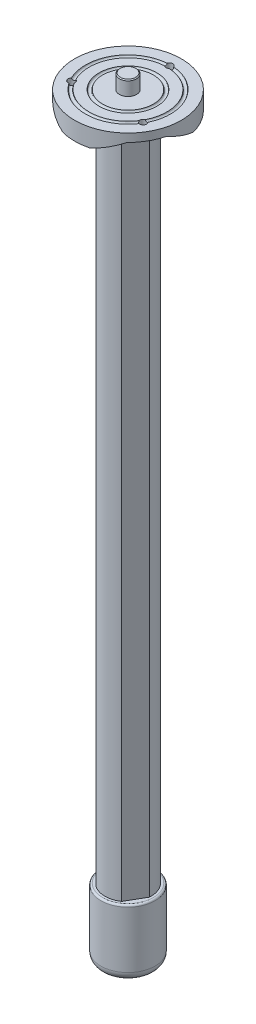
from build123d import *

# Parameters (mm, degrees)
EXTRUDE1_DEPTH                  = 185
SKETCH3_R                       = 29.5
EXTRUDE2_DEPTH                  = 10
SKETCH7_R                       = 1
SKETCH6_OUTSIDE_W               = 138.81
SKETCH6_OUTSIDE_H               = 138.81
SKETCH6_OUTSIDE_R               = 29.5
SKETCH6_OUTSIDE_R_2             = 25.5
EXTRUDE4_DEPTH                  = 5.5
EXTRUDE3_DEPTH                  = 23
CIRPATTERN1_COUNT               = 3
SKETCH8_R                       = 4.7625
EXTRUDE5_DEPTH                  = 8
CHAMFER1_SIZE                   = 0.5
EXTRUDE6_DEPTH                  = 8
FILLET1_R                       = 5
FILLET2_R                       = 1
SKETCH13_W                      = 1.89865
SKETCH13_H                      = 420
F_10_24_TAPPED_HOLE1_AT_2_COUNT = 2
F_10_24_TAPPED_HOLE1_AT_2_PITCH = 39.594681461
F_10_24_TAPPED_HOLE1_AT_3_COUNT = 2
F_10_24_TAPPED_HOLE1_AT_3_PITCH = 39.594681461


with BuildPart() as part:
    # Sketch2 → Extrude1 (new, symmetric)
    with BuildSketch(Plane(origin=(0, 0, 0), x_dir=(1, 0, 0), z_dir=(0, 1, 0))):
        with BuildLine():
            Line((-5.6, 11.45436598), (5.6, 11.45436598))
            ThreePointArc((5.6, 11.45436598), (11.041823898, 6.375), (12.719771923, -0.877440729))
            Line((12.719771923, -0.877440729), (7.119771923, -10.576925251))
            ThreePointArc((7.119771923, -10.576925251), (0, -12.75), (-7.119771923, -10.576925251))
            Line((-7.119771923, -10.576925251), (-12.719771923, -0.877440729))
            ThreePointArc((-12.719771923, -0.877440729), (-11.041823898, 6.375), (-5.6, 11.45436598))
        make_face()
    extrude(amount=EXTRUDE1_DEPTH, both=True)


with BuildPart() as body_2:
    # Sketch3 → Extrude2 (new body)
    with BuildSketch(Plane(origin=(0, 185, 0), x_dir=(1, 0, 0), z_dir=(0, 1, 0))):
        Circle(SKETCH3_R)
    extrude(amount=EXTRUDE2_DEPTH)

    # Sketch7 → Cut-Revolve1 (revolve, cut)
    with BuildSketch(Plane.XY):
        with Locations((15, 195)):
            Circle(SKETCH7_R)
        with Locations((22.5, 195)):
            Circle(SKETCH7_R)
    revolve(axis=Axis((0, 203.822792645, 0), (0, -1, 0)), mode=Mode.SUBTRACT)

    # Sketch6 outside → Extrude4 (cut)
    # profile 1 of 2: a face of its own
    with BuildSketch(Plane.XZ.offset(-185)):
        Rectangle(SKETCH6_OUTSIDE_W, SKETCH6_OUTSIDE_H)
        Circle(SKETCH6_OUTSIDE_R, mode=Mode.SUBTRACT)
    # profile 2 of 2: a face of its own
    with BuildSketch(Plane.XZ.offset(-185)):
        Circle(SKETCH6_OUTSIDE_R_2)
    extrude(amount=-EXTRUDE4_DEPTH, mode=Mode.SUBTRACT)

    # Sketch4 → Extrude3 (cut)
    with BuildSketch(Plane.XY.offset(-35)):
        Polygon((8, 190.5), (-8, 190.5), (-21, 185), (21, 185), align=None)
    extrude3 = extrude(amount=EXTRUDE3_DEPTH, mode=Mode.SUBTRACT)

    # CirPattern1: Extrude3 ×3 about axis
    cirpattern1_axis = Axis((0, 195, 0), (0, -1, 0))
    for i in range(1, CIRPATTERN1_COUNT):
        add(extrude3.rotate(cirpattern1_axis, i * 360 / CIRPATTERN1_COUNT), mode=Mode.SUBTRACT)

    # Sketch13 → #10-24 Tapped Hole1 (revolve, cut)
    with BuildSketch(Plane(origin=(0, 195, -22.86), x_dir=(0, 0, 1), z_dir=(1, 0, 0))):
        with Locations((0.949325, 210)):
            Rectangle(SKETCH13_W, SKETCH13_H)
    f_10_24_tapped_hole1 = revolve(axis=Axis((0, 201.35, -22.86), (0, -1, 0)), mode=Mode.SUBTRACT)

    # #10-24 Tapped Hole1 at 2: #10-24 Tapped Hole1 ×2
    with Locations(*[Vector(0.5000000000000002, 0, 0.8660254037844386) * (i * F_10_24_TAPPED_HOLE1_AT_2_PITCH) for i in range(1, F_10_24_TAPPED_HOLE1_AT_2_COUNT)]):
        add(f_10_24_tapped_hole1, mode=Mode.SUBTRACT)

    # #10-24 Tapped Hole1 at 3: #10-24 Tapped Hole1 ×2
    with Locations(*[Vector(-0.49999999999999967, 0, 0.8660254037844388) * (i * F_10_24_TAPPED_HOLE1_AT_3_PITCH) for i in range(1, F_10_24_TAPPED_HOLE1_AT_3_COUNT)]):
        add(f_10_24_tapped_hole1, mode=Mode.SUBTRACT)


with BuildPart() as body_3:
    # Sketch8 → Extrude5 (new body)
    with BuildSketch(Plane(origin=(0, 195, 0), x_dir=(1, 0, 0), z_dir=(0, 1, 0))):
        Circle(SKETCH8_R)
    extrude(amount=EXTRUDE5_DEPTH)

    # Chamfer1
    chamfer1_edges = [body_3.edges().sort_by_distance(p)[0] for p in [
        (-4.7625, 203, 0),
    ]]
    chamfer(chamfer1_edges, length=CHAMFER1_SIZE)


with BuildPart() as body_4:
    # Sketch9 → Extrude6 (new body)
    with BuildSketch(Plane(origin=(0, 185, 0), x_dir=(1, 0, 0), z_dir=(0, 1, 0))):
        with BuildLine():
            Line((-12.719771923, -0.877440729), (-7.119771923, -10.576925251))
            ThreePointArc((-7.119771923, -10.576925251), (0, -12.75), (7.119771923, -10.576925251))
            Line((7.119771923, -10.576925251), (12.719771923, -0.877440729))
            ThreePointArc((12.719771923, -0.877440729), (11.041823898, 6.375), (5.6, 11.45436598))
            Line((5.6, 11.45436598), (-5.6, 11.45436598))
            ThreePointArc((-5.6, 11.45436598), (-11.041823898, 6.375), (-12.719771923, -0.877440729))
        make_face()
    extrude(amount=EXTRUDE6_DEPTH)

    # Combine1: union part
    add(part.part)


with BuildPart() as body_5:
    # Sketch10 → Revolve1 (revolve)
    with BuildSketch(Plane.XY):
        with BuildLine():
            Line((15, -185), (15, -220))
            ThreePointArc((15, -220), (7.90569415, -223.717082451), (0, -225))
            Line((0, -225), (0, -185))
            Line((0, -185), (15, -185))
        make_face()
    revolve(axis=Axis((0, -185, 0), (0, -1, 0)))

    # Fillet1
    fillet1_edges = [body_5.edges().sort_by_distance(p)[0] for p in [
        (-15, -220, 0),
    ]]
    fillet(fillet1_edges, radius=FILLET1_R)

    # Fillet2
    fillet2_edges = [body_5.edges().sort_by_distance(p)[0] for p in [
        (-15, -185, 0),
    ]]
    fillet(fillet2_edges, radius=FILLET2_R)


solid = Compound([body_2.part, body_3.part, body_4.part, body_5.part])
